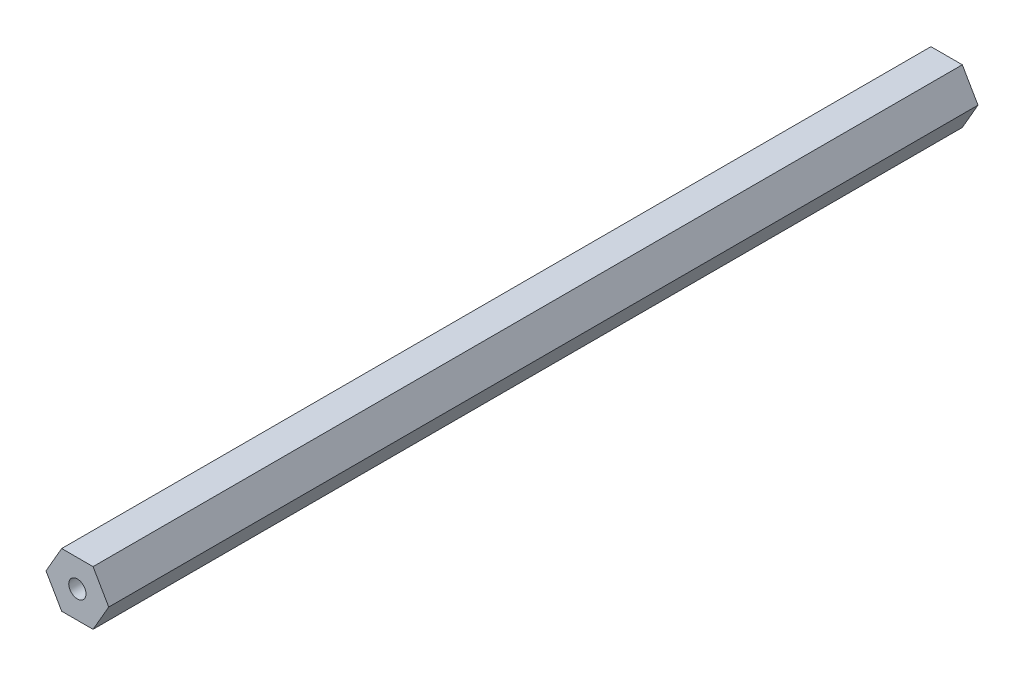
from build123d import *

# Parameters (mm, degrees)
BOSS_EXTRUDE1_DEPTH        = 203.2
F_10_32_TAPPED_HOLE1_D     = 4.0386
F_10_32_TAPPED_HOLE1_DEPTH = 76.2
F_10_32_TAPPED_HOLE1_TIP   = 1.213317848


with BuildPart() as part:
    # Sketch1 → Boss-Extrude1 (new body)
    with BuildSketch(Plane.XY):
        Polygon((7.332348419, 0), (3.666174209, 6.35), (-3.666174209, 6.35), (-7.332348419, 0), (-3.666174209, -6.35), (3.666174209, -6.35), align=None)
    extrude(amount=BOSS_EXTRUDE1_DEPTH)

    # #10-32 Tapped Hole1
    with Locations(Plane.XY.offset(203.2)):
        with Locations((0, 0)):
            Hole(F_10_32_TAPPED_HOLE1_D / 2, depth=F_10_32_TAPPED_HOLE1_DEPTH)
            with Locations((0, 0, -(F_10_32_TAPPED_HOLE1_DEPTH + F_10_32_TAPPED_HOLE1_TIP / 2))):  # 118° drill point
                Cone(0, F_10_32_TAPPED_HOLE1_D / 2, F_10_32_TAPPED_HOLE1_TIP, mode=Mode.SUBTRACT)


solid = part.part
